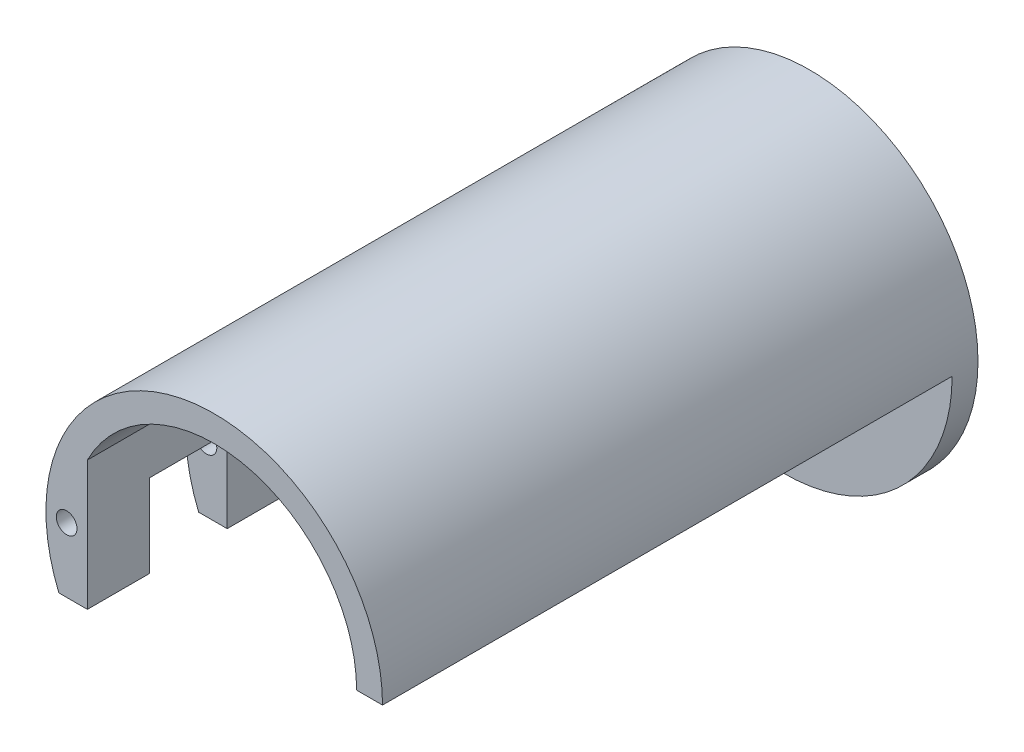
from build123d import *

# Parameters (mm, degrees)
CROQUIS1_R         = 32.5
BASE_DEPTH         = 5
PAREDFIJA_DEPTH    = 110
HUECOVISAGRA_REACH = 134.402
CROQUIS3_W         = 15
CROQUIS3_H         = 16


with BuildPart() as part:
    # Croquis1 → Base (new body)
    with BuildSketch(Plane.XY):
        Circle(CROQUIS1_R)
    extrude(amount=BASE_DEPTH)

    # Croquis2 → ParedFija (add)
    with BuildSketch(Plane.XY.offset(5)):
        with BuildLine():
            Line((-24.5, -12.489995997), (-24.5, 0))
            Line((-24.5, 0), (-24.5, 12.489995997))
            ThreePointArc((-24.5, 12.489995997), (0, 27.5), (24.5, 12.489995997))
            ThreePointArc((24.5, 12.489995997), (26.739483914, 6.422616289), (27.5, 0))
            Line((27.5, 0), (32.5, 0))
            ThreePointArc((32.5, 0), (0, 32.5), (-32.5, 0))
            ThreePointArc((-32.5, 0), (-31.869934164, -6.368461067), (-30.004166377, -12.489995997))
            Line((-30.004166377, -12.489995997), (-24.5, -12.489995997))
        make_face()
        with BuildLine():
            ThreePointArc((-27.447368421, -1.70057836), (-30.5, 0), (-27.447368421, 1.70057836))
            ThreePointArc((-27.447368421, 1.70057836), (-26.752821824, 0.973328527), (-26.5, 0))
            ThreePointArc((-26.5, 0), (-26.752821824, -0.973328527), (-27.447368421, -1.70057836))
        make_face(mode=Mode.SUBTRACT)
    extrude(amount=PAREDFIJA_DEPTH)

    # Croquis3 → HuecoVisagra (cut, up to next)
    with BuildSketch(Plane(origin=(-24.5, 0, 0), x_dir=(0, 0, -1), z_dir=(1, 0, 0)), mode=Mode.PRIVATE) as huecovisagra_sk1:
        with Locations((-95.5, -4.489995997)):
            Rectangle(CROQUIS3_W, CROQUIS3_H)
    huecovisagra_tool1 = extrude(huecovisagra_sk1.sketch, amount=-HUECOVISAGRA_REACH, mode=Mode.PRIVATE) & part.part
    # Croquis3 → HuecoVisagra (cut, up to next)
    with BuildSketch(Plane(origin=(-24.5, 0, 0), x_dir=(0, 0, -1), z_dir=(1, 0, 0)), mode=Mode.PRIVATE) as huecovisagra_sk2:
        with Locations((-24.5, -4.489995997)):
            Rectangle(CROQUIS3_W, CROQUIS3_H)
    huecovisagra_tool2 = extrude(huecovisagra_sk2.sketch, amount=-HUECOVISAGRA_REACH, mode=Mode.PRIVATE) & part.part
    add(huecovisagra_tool1.solids().sort_by_distance((-24.5, -4.489996, 95.5))[0], mode=Mode.SUBTRACT)
    add(huecovisagra_tool2.solids().sort_by_distance((-24.5, -4.489996, 24.5))[0], mode=Mode.SUBTRACT)


solid = part.part
